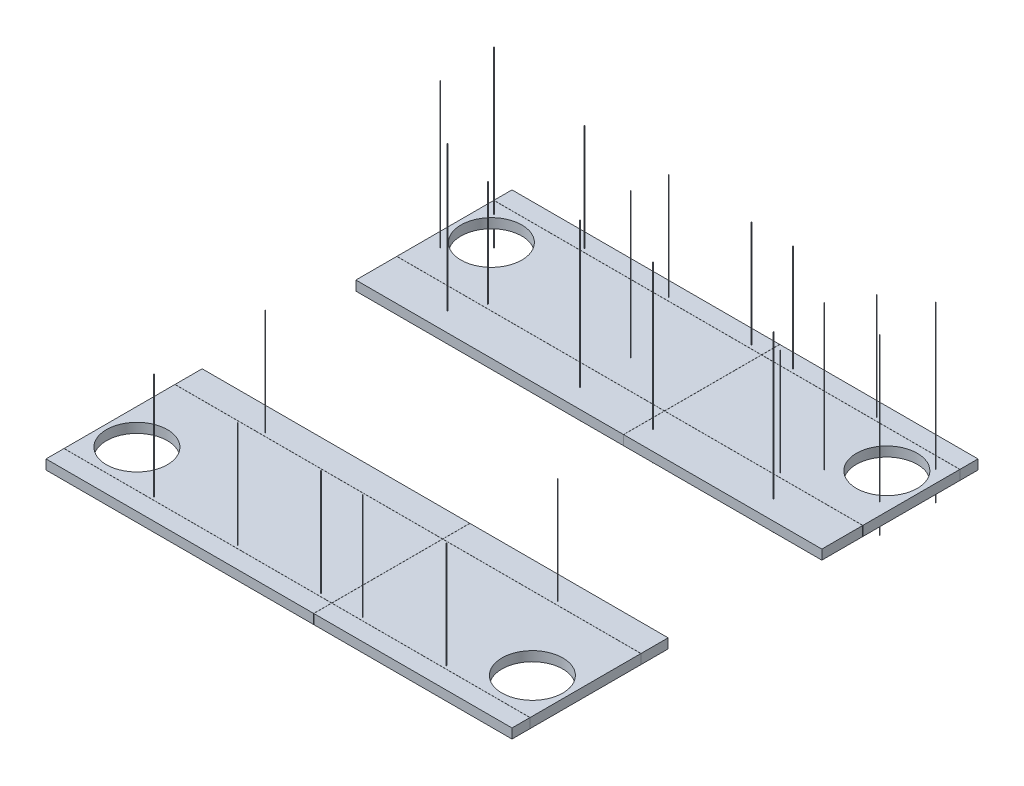
from build123d import *

# Parameters (mm, degrees)
SKETCH1_W                        = 4908.55
SKETCH1_H                        = 4908.55
BOSS_EXTRUDE1_DEPTH              = 101.6
SKETCH2_W                        = 4908.55
SKETCH2_H                        = 1619.25
CUT_EXTRUDE1_DEPTH               = 3473.355700566
SKETCH4_W                        = 4908.55
SKETCH4_H                        = 1.27
CUT_EXTRUDE_THIN1_DEPTH          = 3473.355700566
CUT_EXTRUDE_THIN2_DEPTH          = 3473.355700566
CUT_EXTRUDE_THIN2_DEPTH_BACK     = 3473.355700566
SKETCH5_W                        = 1.27
SKETCH5_H                        = 4908.55
SKETCH6_R                        = 320.675
CUT_EXTRUDE2_DEPTH               = 3473.355700566
STUD_LAYOUT_SKETCH_DEPTH         = 1524
STUD_LAYOUT_SKETCH_DEPTH_BACK    = 304.8
SKETCH7_R                        = 3.175
STUD_LAYOUT_SKETCH_2_DEPTH       = 1524
STUD_LAYOUT_SKETCH_2_DEPTH_BACK  = 304.8
STUD_LAYOUT_SKETCH_3_DEPTH       = 1524
STUD_LAYOUT_SKETCH_3_DEPTH_BACK  = 304.8
STUD_LAYOUT_SKETCH_4_DEPTH       = 1524
STUD_LAYOUT_SKETCH_4_DEPTH_BACK  = 304.8
STUD_LAYOUT_SKETCH_5_DEPTH       = 1524
STUD_LAYOUT_SKETCH_5_DEPTH_BACK  = 304.8
STUD_LAYOUT_SKETCH_6_DEPTH       = 1524
STUD_LAYOUT_SKETCH_6_DEPTH_BACK  = 304.8
STUD_LAYOUT_SKETCH_7_DEPTH       = 1524
STUD_LAYOUT_SKETCH_7_DEPTH_BACK  = 304.8
STUD_LAYOUT_SKETCH_8_DEPTH       = 1524
STUD_LAYOUT_SKETCH_8_DEPTH_BACK  = 304.8
STUD_LAYOUT_SKETCH_9_DEPTH       = 1524
STUD_LAYOUT_SKETCH_9_DEPTH_BACK  = 304.8
STUD_LAYOUT_SKETCH_10_DEPTH      = 1524
STUD_LAYOUT_SKETCH_10_DEPTH_BACK = 304.8
STUD_LAYOUT_SKETCH_11_DEPTH      = 1524
STUD_LAYOUT_SKETCH_11_DEPTH_BACK = 304.8
STUD_LAYOUT_SKETCH_12_DEPTH      = 1524
STUD_LAYOUT_SKETCH_12_DEPTH_BACK = 304.8
STUD_LAYOUT_SKETCH_13_DEPTH      = 1524
STUD_LAYOUT_SKETCH_13_DEPTH_BACK = 304.8
STUD_LAYOUT_SKETCH_14_DEPTH      = 1524
STUD_LAYOUT_SKETCH_14_DEPTH_BACK = 304.8
STUD_LAYOUT_SKETCH_15_DEPTH      = 1524
STUD_LAYOUT_SKETCH_15_DEPTH_BACK = 304.8
STUD_LAYOUT_SKETCH_16_DEPTH      = 1524
STUD_LAYOUT_SKETCH_16_DEPTH_BACK = 304.8
STUD_LAYOUT_SKETCH_17_DEPTH      = 1524
STUD_LAYOUT_SKETCH_17_DEPTH_BACK = 304.8
STUD_LAYOUT_SKETCH_18_DEPTH      = 1524
STUD_LAYOUT_SKETCH_18_DEPTH_BACK = 304.8
STUD_LAYOUT_SKETCH_19_DEPTH      = 1524
STUD_LAYOUT_SKETCH_19_DEPTH_BACK = 304.8
STUD_LAYOUT_SKETCH_20_DEPTH      = 1524
STUD_LAYOUT_SKETCH_20_DEPTH_BACK = 304.8
STUD_LAYOUT_SKETCH_21_DEPTH      = 1524
STUD_LAYOUT_SKETCH_21_DEPTH_BACK = 304.8
STUD_LAYOUT_SKETCH_22_DEPTH      = 1524
STUD_LAYOUT_SKETCH_22_DEPTH_BACK = 304.8
STUD_LAYOUT_SKETCH_23_DEPTH      = 1524
STUD_LAYOUT_SKETCH_23_DEPTH_BACK = 304.8
STUD_LAYOUT_SKETCH_24_DEPTH      = 1524
STUD_LAYOUT_SKETCH_24_DEPTH_BACK = 304.8
SKETCH8_W                        = 5497.787174958
SKETCH8_H                        = 7518.420007062
CUT_EXTRUDE5_DEPTH               = 406.4
SKETCH9_W                        = 5184.868781488
SKETCH9_H                        = 7370.4919608
CUT_EXTRUDE6_DEPTH               = 254


with BuildPart() as part:
    # Sketch1 → Boss-Extrude1 (new body)
    with BuildSketch(Plane(origin=(0, 0, 0), x_dir=(1, 0, 0), z_dir=(0, 1, 0))):
        Rectangle(SKETCH1_W, SKETCH1_H)
    extrude(amount=BOSS_EXTRUDE1_DEPTH)

    # Sketch2 → Cut-Extrude1 (cut, through all)
    with BuildSketch(Plane(origin=(0, 101.6, 0), x_dir=(1, 0, 0), z_dir=(0, 1, 0))):
        Rectangle(SKETCH2_W, SKETCH2_H)
    extrude(amount=-CUT_EXTRUDE1_DEPTH, mode=Mode.SUBTRACT)


with BuildPart() as cut_extrude1_piece_1:
    # of the separate pieces the step leaves, piece 1, a body of its own (cut_extrude1_pieces)
    add(part.part.solids().sort_by_distance((-2454.275, 0, -2454.275))[0])


with BuildPart() as cut_extrude1_piece_2:
    # of the separate pieces the step leaves, piece 2, a body of its own (cut_extrude1_pieces)
    add(part.part.solids().sort_by_distance((-2454.275, 0, 2454.275))[0])


with BuildPart() as cut_extrude_thin1_tool:
    # Sketch4 → Cut-Extrude-Thin1 (new, through all)
    with BuildSketch(Plane(origin=(0, 101.6, 0), x_dir=(1, 0, 0), z_dir=(0, 1, 0))):
        with Locations((0, -2264.41)):
            Rectangle(SKETCH4_W, SKETCH4_H)
        with Locations((0, -1096.01)):
            Rectangle(SKETCH4_W, SKETCH4_H)
        with Locations((0, 2263.14)):
            Rectangle(SKETCH4_W, SKETCH4_H)
        with Locations((0, 1240.79)):
            Rectangle(SKETCH4_W, SKETCH4_H)
    extrude(amount=-CUT_EXTRUDE_THIN1_DEPTH)


with BuildPart() as cut_extrude1_piece_1_1:
    add(cut_extrude1_piece_1.part)

    # Cut-Extrude-Thin1: cut by cut_extrude_thin1_tool
    add(cut_extrude_thin1_tool.part, mode=Mode.SUBTRACT)


with BuildPart() as cut_extrude1_piece_2_1:
    add(cut_extrude1_piece_2.part)

    # Cut-Extrude-Thin1: cut by cut_extrude_thin1_tool
    add(cut_extrude_thin1_tool.part, mode=Mode.SUBTRACT)


with BuildPart() as cut_extrude_thin1_piece_1:
    # of the separate pieces the step leaves, piece 1, a body of its own (cut_extrude_thin1_pieces)
    add(cut_extrude1_piece_1_1.part.solids().sort_by_distance((-2454.275, 0, -1241.425))[0])


with BuildPart() as cut_extrude_thin1_piece_2:
    # of the separate pieces the step leaves, piece 2, a body of its own (cut_extrude_thin1_pieces)
    add(cut_extrude1_piece_1_1.part.solids().sort_by_distance((-2454.275, 0, -809.625))[0])


with BuildPart() as cut_extrude_thin1_piece_3:
    # of the separate pieces the step leaves, piece 3, a body of its own (cut_extrude_thin1_pieces)
    add(cut_extrude1_piece_1_1.part.solids().sort_by_distance((-2454.275, 0, -2454.275))[0])


with BuildPart() as cut_extrude_thin1_piece_1_of_cut_extrude:
    # of the separate pieces the step leaves, piece 1, a body of its own (cut_extrude_thin1_pieces_of_cut_extrude1)
    add(cut_extrude1_piece_2_1.part.solids().sort_by_distance((-2454.275, 0, 2263.775))[0])


with BuildPart() as cut_extrude_thin1_piece_2_of_cut_extrude:
    # of the separate pieces the step leaves, piece 2, a body of its own (cut_extrude_thin1_pieces_of_cut_extrude1)
    add(cut_extrude1_piece_2_1.part.solids().sort_by_distance((-2454.275, 0, 1095.375))[0])


with BuildPart() as cut_extrude_thin1_piece_3_of_cut_extrude:
    # of the separate pieces the step leaves, piece 3, a body of its own (cut_extrude_thin1_pieces_of_cut_extrude1)
    add(cut_extrude1_piece_2_1.part.solids().sort_by_distance((-2454.275, 0, 2454.275))[0])


with BuildPart() as cut_extrude_thin2_tool:
    # Sketch5 → Cut-Extrude-Thin2 (new, two sides: drawn at the far end of the back side and taken through both)
    with BuildSketch(Plane(origin=(0, 101.6, 0), x_dir=(1, 0, 0), z_dir=(0, 1, 0)).offset(-CUT_EXTRUDE_THIN2_DEPTH_BACK)):
        with Locations((365.76, 0)):
            Rectangle(SKETCH5_W, SKETCH5_H)
    extrude(amount=CUT_EXTRUDE_THIN2_DEPTH + CUT_EXTRUDE_THIN2_DEPTH_BACK)


with BuildPart() as cut_extrude_thin1_piece_1_1:
    add(cut_extrude_thin1_piece_1.part)

    # Cut-Extrude-Thin2: cut by cut_extrude_thin2_tool
    add(cut_extrude_thin2_tool.part, mode=Mode.SUBTRACT)


with BuildPart() as cut_extrude_thin1_piece_2_1:
    add(cut_extrude_thin1_piece_2.part)

    # Cut-Extrude-Thin2: cut by cut_extrude_thin2_tool
    add(cut_extrude_thin2_tool.part, mode=Mode.SUBTRACT)


with BuildPart() as cut_extrude_thin1_piece_3_1:
    add(cut_extrude_thin1_piece_3.part)

    # Cut-Extrude-Thin2: cut by cut_extrude_thin2_tool
    add(cut_extrude_thin2_tool.part, mode=Mode.SUBTRACT)


with BuildPart() as cut_extrude_thin1_piece_1_of_cut_extrude_1:
    add(cut_extrude_thin1_piece_1_of_cut_extrude.part)

    # Cut-Extrude-Thin2: cut by cut_extrude_thin2_tool
    add(cut_extrude_thin2_tool.part, mode=Mode.SUBTRACT)


with BuildPart() as cut_extrude_thin1_piece_2_of_cut_extrude_1:
    add(cut_extrude_thin1_piece_2_of_cut_extrude.part)

    # Cut-Extrude-Thin2: cut by cut_extrude_thin2_tool
    add(cut_extrude_thin2_tool.part, mode=Mode.SUBTRACT)


with BuildPart() as cut_extrude_thin1_piece_3_of_cut_extrude_1:
    add(cut_extrude_thin1_piece_3_of_cut_extrude.part)

    # Cut-Extrude-Thin2: cut by cut_extrude_thin2_tool
    add(cut_extrude_thin2_tool.part, mode=Mode.SUBTRACT)


with BuildPart() as cut_extrude_thin2_piece_1:
    # of the separate pieces the step leaves, piece 1, a body of its own (cut_extrude_thin2_pieces)
    add(cut_extrude_thin1_piece_1_1.part.solids().sort_by_distance((-2454.275, 0, -1241.425))[0])


with BuildPart() as cut_extrude_thin2_piece_2:
    # of the separate pieces the step leaves, piece 2, a body of its own (cut_extrude_thin2_pieces)
    add(cut_extrude_thin1_piece_1_1.part.solids().sort_by_distance((2454.275, 0, -2262.505))[0])


with BuildPart() as cut_extrude_thin2_piece_1_of_cut_extrude:
    # of the separate pieces the step leaves, piece 1, a body of its own (cut_extrude_thin2_pieces_of_cut_extrude)
    add(cut_extrude_thin1_piece_2_1.part.solids().sort_by_distance((-2454.275, 0, -809.625))[0])


with BuildPart() as cut_extrude_thin2_piece_2_of_cut_extrude:
    # of the separate pieces the step leaves, piece 2, a body of its own (cut_extrude_thin2_pieces_of_cut_extrude)
    add(cut_extrude_thin1_piece_2_1.part.solids().sort_by_distance((2454.275, 0, -1240.155))[0])


with BuildPart() as cut_extrude_thin2_piece_1_of_cut_ext_2:
    # of the separate pieces the step leaves, piece 1, a body of its own (cut_extrude_thin2_pieces_of_cut_extr_2)
    add(cut_extrude_thin1_piece_3_1.part.solids().sort_by_distance((-2454.275, 0, -2454.275))[0])


with BuildPart() as cut_extrude_thin2_piece_2_of_cut_ext_2:
    # of the separate pieces the step leaves, piece 2, a body of its own (cut_extrude_thin2_pieces_of_cut_extr_2)
    add(cut_extrude_thin1_piece_3_1.part.solids().sort_by_distance((366.395, 0, -2454.275))[0])


with BuildPart() as cut_extrude_thin2_piece_1_of_cut_ext_3:
    # of the separate pieces the step leaves, piece 1, a body of its own (cut_extrude_thin2_pieces_of_cut_extr_3)
    add(cut_extrude_thin1_piece_1_of_cut_extrude_1.part.solids().sort_by_distance((-2454.275, 0, 2263.775))[0])


with BuildPart() as cut_extrude_thin2_piece_2_of_cut_ext_3:
    # of the separate pieces the step leaves, piece 2, a body of its own (cut_extrude_thin2_pieces_of_cut_extr_3)
    add(cut_extrude_thin1_piece_1_of_cut_extrude_1.part.solids().sort_by_distance((2454.275, 0, 1096.645))[0])


with BuildPart() as cut_extrude_thin2_piece_1_of_cut_ext_4:
    # of the separate pieces the step leaves, piece 1, a body of its own (cut_extrude_thin2_pieces_of_cut_extr_4)
    add(cut_extrude_thin1_piece_2_of_cut_extrude_1.part.solids().sort_by_distance((-2454.275, 0, 1095.375))[0])


with BuildPart() as cut_extrude_thin2_piece_2_of_cut_ext_4:
    # of the separate pieces the step leaves, piece 2, a body of its own (cut_extrude_thin2_pieces_of_cut_extr_4)
    add(cut_extrude_thin1_piece_2_of_cut_extrude_1.part.solids().sort_by_distance((2454.275, 0, 809.625))[0])


with BuildPart() as cut_extrude_thin2_piece_1_of_cut_ext_5:
    # of the separate pieces the step leaves, piece 1, a body of its own (cut_extrude_thin2_pieces_of_cut_extr_5)
    add(cut_extrude_thin1_piece_3_of_cut_extrude_1.part.solids().sort_by_distance((-2454.275, 0, 2454.275))[0])


with BuildPart() as cut_extrude_thin2_piece_2_of_cut_ext_5:
    # of the separate pieces the step leaves, piece 2, a body of its own (cut_extrude_thin2_pieces_of_cut_extr_5)
    add(cut_extrude_thin1_piece_3_of_cut_extrude_1.part.solids().sort_by_distance((2454.275, 0, 2265.045))[0])


with BuildPart() as cut_extrude2_tool:
    # Sketch6 → Cut-Extrude2 (new, through all)
    with BuildSketch(Plane(origin=(0, 101.6, 0), x_dir=(1, 0, 0), z_dir=(0, 1, 0))):
        with Locations((2082.8, 1865.63)):
            Circle(SKETCH6_R)
        with Locations((-2082.8, 1865.63)):
            Circle(SKETCH6_R)
        with Locations((-2082.8, -1868.17)):
            Circle(SKETCH6_R)
        with Locations((2082.8, -1868.17)):
            Circle(SKETCH6_R)
    extrude(amount=-CUT_EXTRUDE2_DEPTH)


with BuildPart() as cut_extrude_thin2_piece_1_1:
    add(cut_extrude_thin2_piece_1.part)

    # Cut-Extrude2: cut by cut_extrude2_tool
    add(cut_extrude2_tool.part, mode=Mode.SUBTRACT)


with BuildPart() as cut_extrude_thin2_piece_2_1:
    add(cut_extrude_thin2_piece_2.part)

    # Cut-Extrude2: cut by cut_extrude2_tool
    add(cut_extrude2_tool.part, mode=Mode.SUBTRACT)


with BuildPart() as cut_extrude_thin2_piece_1_of_cut_ext_3_1:
    add(cut_extrude_thin2_piece_1_of_cut_ext_3.part)

    # Cut-Extrude2: cut by cut_extrude2_tool
    add(cut_extrude2_tool.part, mode=Mode.SUBTRACT)


with BuildPart() as cut_extrude_thin2_piece_2_of_cut_ext_3_1:
    add(cut_extrude_thin2_piece_2_of_cut_ext_3.part)

    # Cut-Extrude2: cut by cut_extrude2_tool
    add(cut_extrude2_tool.part, mode=Mode.SUBTRACT)


with BuildPart() as body_13:
    # Sketch7 → STUD LAYOUT SKETCH (new, two sides: drawn at the far end of the back side and taken through both)
    with BuildSketch(Plane(origin=(0, 101.6, 0), x_dir=(1, 0, 0), z_dir=(0, 1, 0)).offset(-STUD_LAYOUT_SKETCH_DEPTH_BACK)):
        with Locations((-1539.875, 2301.875)):
            Circle(SKETCH7_R)
    extrude(amount=STUD_LAYOUT_SKETCH_DEPTH + STUD_LAYOUT_SKETCH_DEPTH_BACK)


with BuildPart() as body_14:
    # Sketch7 → STUD LAYOUT SKETCH 2 (new, two sides: drawn at the far end of the back side and taken through both)
    with BuildSketch(Plane(origin=(0, 101.6, 0), x_dir=(1, 0, 0), z_dir=(0, 1, 0)).offset(-STUD_LAYOUT_SKETCH_2_DEPTH_BACK)):
        with Locations((1743.075, 1546.225)):
            Circle(SKETCH7_R)
    extrude(amount=STUD_LAYOUT_SKETCH_2_DEPTH + STUD_LAYOUT_SKETCH_2_DEPTH_BACK)


with BuildPart() as body_15:
    # Sketch7 → STUD LAYOUT SKETCH 3 (new, two sides: drawn at the far end of the back side and taken through both)
    with BuildSketch(Plane(origin=(0, 101.6, 0), x_dir=(1, 0, 0), z_dir=(0, 1, 0)).offset(-STUD_LAYOUT_SKETCH_3_DEPTH_BACK)):
        with Locations((473.075, 1012.825)):
            Circle(SKETCH7_R)
    extrude(amount=STUD_LAYOUT_SKETCH_3_DEPTH + STUD_LAYOUT_SKETCH_3_DEPTH_BACK)


with BuildPart() as body_16:
    # Sketch7 → STUD LAYOUT SKETCH 4 (new, two sides: drawn at the far end of the back side and taken through both)
    with BuildSketch(Plane(origin=(0, 101.6, 0), x_dir=(1, 0, 0), z_dir=(0, 1, 0)).offset(-STUD_LAYOUT_SKETCH_4_DEPTH_BACK)):
        with Locations((-295.275, 1546.225)):
            Circle(SKETCH7_R)
    extrude(amount=STUD_LAYOUT_SKETCH_4_DEPTH + STUD_LAYOUT_SKETCH_4_DEPTH_BACK)


with BuildPart() as body_17:
    # Sketch7 → STUD LAYOUT SKETCH 5 (new, two sides: drawn at the far end of the back side and taken through both)
    with BuildSketch(Plane(origin=(0, 101.6, 0), x_dir=(1, 0, 0), z_dir=(0, 1, 0)).offset(-STUD_LAYOUT_SKETCH_5_DEPTH_BACK)):
        with Locations((-295.275, 1012.825)):
            Circle(SKETCH7_R)
    extrude(amount=STUD_LAYOUT_SKETCH_5_DEPTH + STUD_LAYOUT_SKETCH_5_DEPTH_BACK)


with BuildPart() as body_18:
    # Sketch7 → STUD LAYOUT SKETCH 6 (new, two sides: drawn at the far end of the back side and taken through both)
    with BuildSketch(Plane(origin=(0, 101.6, 0), x_dir=(1, 0, 0), z_dir=(0, 1, 0)).offset(-STUD_LAYOUT_SKETCH_6_DEPTH_BACK)):
        with Locations((-1692.275, 1012.825)):
            Circle(SKETCH7_R)
    extrude(amount=STUD_LAYOUT_SKETCH_6_DEPTH + STUD_LAYOUT_SKETCH_6_DEPTH_BACK)


with BuildPart() as body_19:
    # Sketch7 → STUD LAYOUT SKETCH 7 (new, two sides: drawn at the far end of the back side and taken through both)
    with BuildSketch(Plane(origin=(0, 101.6, 0), x_dir=(1, 0, 0), z_dir=(0, 1, 0)).offset(-STUD_LAYOUT_SKETCH_7_DEPTH_BACK)):
        with Locations((1743.075, 1012.825)):
            Circle(SKETCH7_R)
    extrude(amount=STUD_LAYOUT_SKETCH_7_DEPTH + STUD_LAYOUT_SKETCH_7_DEPTH_BACK)


with BuildPart() as body_20:
    # Sketch7 → STUD LAYOUT SKETCH 8 (new, two sides: drawn at the far end of the back side and taken through both)
    with BuildSketch(Plane(origin=(0, 101.6, 0), x_dir=(1, 0, 0), z_dir=(0, 1, 0)).offset(-STUD_LAYOUT_SKETCH_8_DEPTH_BACK)):
        with Locations((-2301.875, 1546.225)):
            Circle(SKETCH7_R)
    extrude(amount=STUD_LAYOUT_SKETCH_8_DEPTH + STUD_LAYOUT_SKETCH_8_DEPTH_BACK)


with BuildPart() as body_21:
    # Sketch7 → STUD LAYOUT SKETCH 9 (new, two sides: drawn at the far end of the back side and taken through both)
    with BuildSketch(Plane(origin=(0, 101.6, 0), x_dir=(1, 0, 0), z_dir=(0, 1, 0)).offset(-STUD_LAYOUT_SKETCH_9_DEPTH_BACK)):
        with Locations((2327.275, 1546.225)):
            Circle(SKETCH7_R)
    extrude(amount=STUD_LAYOUT_SKETCH_9_DEPTH + STUD_LAYOUT_SKETCH_9_DEPTH_BACK)


with BuildPart() as body_22:
    # Sketch7 → STUD LAYOUT SKETCH 10 (new, two sides: drawn at the far end of the back side and taken through both)
    with BuildSketch(Plane(origin=(0, 101.6, 0), x_dir=(1, 0, 0), z_dir=(0, 1, 0)).offset(-STUD_LAYOUT_SKETCH_10_DEPTH_BACK)):
        with Locations((-2327.275, 2136.775)):
            Circle(SKETCH7_R)
    extrude(amount=STUD_LAYOUT_SKETCH_10_DEPTH + STUD_LAYOUT_SKETCH_10_DEPTH_BACK)


with BuildPart() as body_23:
    # Sketch7 → STUD LAYOUT SKETCH 11 (new, two sides: drawn at the far end of the back side and taken through both)
    with BuildSketch(Plane(origin=(0, 101.6, 0), x_dir=(1, 0, 0), z_dir=(0, 1, 0)).offset(-STUD_LAYOUT_SKETCH_11_DEPTH_BACK)):
        with Locations((2327.275, 2136.775)):
            Circle(SKETCH7_R)
    extrude(amount=STUD_LAYOUT_SKETCH_11_DEPTH + STUD_LAYOUT_SKETCH_11_DEPTH_BACK)


with BuildPart() as body_24:
    # Sketch7 → STUD LAYOUT SKETCH 12 (new, two sides: drawn at the far end of the back side and taken through both)
    with BuildSketch(Plane(origin=(0, 101.6, 0), x_dir=(1, 0, 0), z_dir=(0, 1, 0)).offset(-STUD_LAYOUT_SKETCH_12_DEPTH_BACK)):
        with Locations((219.075, 2301.875)):
            Circle(SKETCH7_R)
    extrude(amount=STUD_LAYOUT_SKETCH_12_DEPTH + STUD_LAYOUT_SKETCH_12_DEPTH_BACK)


with BuildPart() as body_25:
    # Sketch7 → STUD LAYOUT SKETCH 13 (new, two sides: drawn at the far end of the back side and taken through both)
    with BuildSketch(Plane(origin=(0, 101.6, 0), x_dir=(1, 0, 0), z_dir=(0, 1, 0)).offset(-STUD_LAYOUT_SKETCH_13_DEPTH_BACK)):
        with Locations((658.495, 2301.875)):
            Circle(SKETCH7_R)
    extrude(amount=STUD_LAYOUT_SKETCH_13_DEPTH + STUD_LAYOUT_SKETCH_13_DEPTH_BACK)


with BuildPart() as body_26:
    # Sketch7 → STUD LAYOUT SKETCH 14 (new, two sides: drawn at the far end of the back side and taken through both)
    with BuildSketch(Plane(origin=(0, 101.6, 0), x_dir=(1, 0, 0), z_dir=(0, 1, 0)).offset(-STUD_LAYOUT_SKETCH_14_DEPTH_BACK)):
        with Locations((1539.875, 2301.875)):
            Circle(SKETCH7_R)
    extrude(amount=STUD_LAYOUT_SKETCH_14_DEPTH + STUD_LAYOUT_SKETCH_14_DEPTH_BACK)


with BuildPart() as body_27:
    # Sketch7 → STUD LAYOUT SKETCH 15 (new, two sides: drawn at the far end of the back side and taken through both)
    with BuildSketch(Plane(origin=(0, 101.6, 0), x_dir=(1, 0, 0), z_dir=(0, 1, 0)).offset(-STUD_LAYOUT_SKETCH_15_DEPTH_BACK)):
        with Locations((-650.875, 2301.875)):
            Circle(SKETCH7_R)
    extrude(amount=STUD_LAYOUT_SKETCH_15_DEPTH + STUD_LAYOUT_SKETCH_15_DEPTH_BACK)


with BuildPart() as body_28:
    # Sketch7 → STUD LAYOUT SKETCH 16 (new, two sides: drawn at the far end of the back side and taken through both)
    with BuildSketch(Plane(origin=(0, 101.6, 0), x_dir=(1, 0, 0), z_dir=(0, 1, 0)).offset(-STUD_LAYOUT_SKETCH_16_DEPTH_BACK)):
        with Locations((-1539.875, 1285.875)):
            Circle(SKETCH7_R)
    extrude(amount=STUD_LAYOUT_SKETCH_16_DEPTH + STUD_LAYOUT_SKETCH_16_DEPTH_BACK)


with BuildPart() as body_29:
    # Sketch7 → STUD LAYOUT SKETCH 17 (new, two sides: drawn at the far end of the back side and taken through both)
    with BuildSketch(Plane(origin=(0, 101.6, 0), x_dir=(1, 0, 0), z_dir=(0, 1, 0)).offset(-STUD_LAYOUT_SKETCH_17_DEPTH_BACK)):
        with Locations((1539.875, 1285.875)):
            Circle(SKETCH7_R)
    extrude(amount=STUD_LAYOUT_SKETCH_17_DEPTH + STUD_LAYOUT_SKETCH_17_DEPTH_BACK)


with BuildPart() as body_30:
    # Sketch7 → STUD LAYOUT SKETCH 18 (new, two sides: drawn at the far end of the back side and taken through both)
    with BuildSketch(Plane(origin=(0, 101.6, 0), x_dir=(1, 0, 0), z_dir=(0, 1, 0)).offset(-STUD_LAYOUT_SKETCH_18_DEPTH_BACK)):
        with Locations((-1539.875, -1058.595975439)):
            Circle(SKETCH7_R)
    extrude(amount=STUD_LAYOUT_SKETCH_18_DEPTH + STUD_LAYOUT_SKETCH_18_DEPTH_BACK)


with BuildPart() as body_31:
    # Sketch7 → STUD LAYOUT SKETCH 19 (new, two sides: drawn at the far end of the back side and taken through both)
    with BuildSketch(Plane(origin=(0, 101.6, 0), x_dir=(1, 0, 0), z_dir=(0, 1, 0)).offset(-STUD_LAYOUT_SKETCH_19_DEPTH_BACK)):
        with Locations((-1539.875, -2230.249923642)):
            Circle(SKETCH7_R)
    extrude(amount=STUD_LAYOUT_SKETCH_19_DEPTH + STUD_LAYOUT_SKETCH_19_DEPTH_BACK)


with BuildPart() as body_32:
    # Sketch7 → STUD LAYOUT SKETCH 20 (new, two sides: drawn at the far end of the back side and taken through both)
    with BuildSketch(Plane(origin=(0, 101.6, 0), x_dir=(1, 0, 0), z_dir=(0, 1, 0)).offset(-STUD_LAYOUT_SKETCH_20_DEPTH_BACK)):
        with Locations((-658.765974284, -2230.249923642)):
            Circle(SKETCH7_R)
    extrude(amount=STUD_LAYOUT_SKETCH_20_DEPTH + STUD_LAYOUT_SKETCH_20_DEPTH_BACK)


with BuildPart() as body_33:
    # Sketch7 → STUD LAYOUT SKETCH 21 (new, two sides: drawn at the far end of the back side and taken through both)
    with BuildSketch(Plane(origin=(0, 101.6, 0), x_dir=(1, 0, 0), z_dir=(0, 1, 0)).offset(-STUD_LAYOUT_SKETCH_21_DEPTH_BACK)):
        with Locations((219.075, -2230.249923642)):
            Circle(SKETCH7_R)
    extrude(amount=STUD_LAYOUT_SKETCH_21_DEPTH + STUD_LAYOUT_SKETCH_21_DEPTH_BACK)


with BuildPart() as body_34:
    # Sketch7 → STUD LAYOUT SKETCH 22 (new, two sides: drawn at the far end of the back side and taken through both)
    with BuildSketch(Plane(origin=(0, 101.6, 0), x_dir=(1, 0, 0), z_dir=(0, 1, 0)).offset(-STUD_LAYOUT_SKETCH_22_DEPTH_BACK)):
        with Locations((658.495, -2230.249923642)):
            Circle(SKETCH7_R)
    extrude(amount=STUD_LAYOUT_SKETCH_22_DEPTH + STUD_LAYOUT_SKETCH_22_DEPTH_BACK)


with BuildPart() as body_35:
    # Sketch7 → STUD LAYOUT SKETCH 23 (new, two sides: drawn at the far end of the back side and taken through both)
    with BuildSketch(Plane(origin=(0, 101.6, 0), x_dir=(1, 0, 0), z_dir=(0, 1, 0)).offset(-STUD_LAYOUT_SKETCH_23_DEPTH_BACK)):
        with Locations((1539.875, -2230.249923642)):
            Circle(SKETCH7_R)
    extrude(amount=STUD_LAYOUT_SKETCH_23_DEPTH + STUD_LAYOUT_SKETCH_23_DEPTH_BACK)


with BuildPart() as body_36:
    # Sketch7 → STUD LAYOUT SKETCH 24 (new, two sides: drawn at the far end of the back side and taken through both)
    with BuildSketch(Plane(origin=(0, 101.6, 0), x_dir=(1, 0, 0), z_dir=(0, 1, 0)).offset(-STUD_LAYOUT_SKETCH_24_DEPTH_BACK)):
        with Locations((1539.875, -1058.595975439)):
            Circle(SKETCH7_R)
    extrude(amount=STUD_LAYOUT_SKETCH_24_DEPTH + STUD_LAYOUT_SKETCH_24_DEPTH_BACK)


with BuildPart() as cut_extrude5_tool:
    # Sketch8 → Cut-Extrude5 (new body)
    with BuildSketch(Plane(origin=(0, 1625.6, 0), x_dir=(1, 0, 0), z_dir=(0, 1, 0))):
        Rectangle(SKETCH8_W, SKETCH8_H)
    extrude(amount=-CUT_EXTRUDE5_DEPTH)


with BuildPart() as body_13_1:
    add(body_13.part)

    # Cut-Extrude5: cut by cut_extrude5_tool
    add(cut_extrude5_tool.part, mode=Mode.SUBTRACT)


with BuildPart() as body_24_1:
    add(body_24.part)

    # Cut-Extrude5: cut by cut_extrude5_tool
    add(cut_extrude5_tool.part, mode=Mode.SUBTRACT)


with BuildPart() as body_25_1:
    add(body_25.part)

    # Cut-Extrude5: cut by cut_extrude5_tool
    add(cut_extrude5_tool.part, mode=Mode.SUBTRACT)


with BuildPart() as body_26_1:
    add(body_26.part)

    # Cut-Extrude5: cut by cut_extrude5_tool
    add(cut_extrude5_tool.part, mode=Mode.SUBTRACT)


with BuildPart() as body_27_1:
    add(body_27.part)

    # Cut-Extrude5: cut by cut_extrude5_tool
    add(cut_extrude5_tool.part, mode=Mode.SUBTRACT)


with BuildPart() as body_28_1:
    add(body_28.part)

    # Cut-Extrude5: cut by cut_extrude5_tool
    add(cut_extrude5_tool.part, mode=Mode.SUBTRACT)


with BuildPart() as body_29_1:
    add(body_29.part)

    # Cut-Extrude5: cut by cut_extrude5_tool
    add(cut_extrude5_tool.part, mode=Mode.SUBTRACT)


with BuildPart() as body_30_1:
    add(body_30.part)

    # Cut-Extrude5: cut by cut_extrude5_tool
    add(cut_extrude5_tool.part, mode=Mode.SUBTRACT)


with BuildPart() as body_31_1:
    add(body_31.part)

    # Cut-Extrude5: cut by cut_extrude5_tool
    add(cut_extrude5_tool.part, mode=Mode.SUBTRACT)


with BuildPart() as body_32_1:
    add(body_32.part)

    # Cut-Extrude5: cut by cut_extrude5_tool
    add(cut_extrude5_tool.part, mode=Mode.SUBTRACT)


with BuildPart() as body_33_1:
    add(body_33.part)

    # Cut-Extrude5: cut by cut_extrude5_tool
    add(cut_extrude5_tool.part, mode=Mode.SUBTRACT)


with BuildPart() as body_34_1:
    add(body_34.part)

    # Cut-Extrude5: cut by cut_extrude5_tool
    add(cut_extrude5_tool.part, mode=Mode.SUBTRACT)


with BuildPart() as body_35_1:
    add(body_35.part)

    # Cut-Extrude5: cut by cut_extrude5_tool
    add(cut_extrude5_tool.part, mode=Mode.SUBTRACT)


with BuildPart() as body_36_1:
    add(body_36.part)

    # Cut-Extrude5: cut by cut_extrude5_tool
    add(cut_extrude5_tool.part, mode=Mode.SUBTRACT)


with BuildPart() as cut_extrude6_tool:
    # Sketch9 → Cut-Extrude6 (new body)
    with BuildSketch(Plane.XZ.offset(203.2)):
        Rectangle(SKETCH9_W, SKETCH9_H)
    extrude(amount=-CUT_EXTRUDE6_DEPTH)


with BuildPart() as body_13_2:
    add(body_13_1.part)

    # Cut-Extrude6: cut by cut_extrude6_tool
    add(cut_extrude6_tool.part, mode=Mode.SUBTRACT)


with BuildPart() as body_24_2:
    add(body_24_1.part)

    # Cut-Extrude6: cut by cut_extrude6_tool
    add(cut_extrude6_tool.part, mode=Mode.SUBTRACT)


with BuildPart() as body_25_2:
    add(body_25_1.part)

    # Cut-Extrude6: cut by cut_extrude6_tool
    add(cut_extrude6_tool.part, mode=Mode.SUBTRACT)


with BuildPart() as body_26_2:
    add(body_26_1.part)

    # Cut-Extrude6: cut by cut_extrude6_tool
    add(cut_extrude6_tool.part, mode=Mode.SUBTRACT)


with BuildPart() as body_27_2:
    add(body_27_1.part)

    # Cut-Extrude6: cut by cut_extrude6_tool
    add(cut_extrude6_tool.part, mode=Mode.SUBTRACT)


with BuildPart() as body_28_2:
    add(body_28_1.part)

    # Cut-Extrude6: cut by cut_extrude6_tool
    add(cut_extrude6_tool.part, mode=Mode.SUBTRACT)


with BuildPart() as body_29_2:
    add(body_29_1.part)

    # Cut-Extrude6: cut by cut_extrude6_tool
    add(cut_extrude6_tool.part, mode=Mode.SUBTRACT)


with BuildPart() as body_30_2:
    add(body_30_1.part)

    # Cut-Extrude6: cut by cut_extrude6_tool
    add(cut_extrude6_tool.part, mode=Mode.SUBTRACT)


with BuildPart() as body_31_2:
    add(body_31_1.part)

    # Cut-Extrude6: cut by cut_extrude6_tool
    add(cut_extrude6_tool.part, mode=Mode.SUBTRACT)


with BuildPart() as body_32_2:
    add(body_32_1.part)

    # Cut-Extrude6: cut by cut_extrude6_tool
    add(cut_extrude6_tool.part, mode=Mode.SUBTRACT)


with BuildPart() as body_33_2:
    add(body_33_1.part)

    # Cut-Extrude6: cut by cut_extrude6_tool
    add(cut_extrude6_tool.part, mode=Mode.SUBTRACT)


with BuildPart() as body_34_2:
    add(body_34_1.part)

    # Cut-Extrude6: cut by cut_extrude6_tool
    add(cut_extrude6_tool.part, mode=Mode.SUBTRACT)


with BuildPart() as body_35_2:
    add(body_35_1.part)

    # Cut-Extrude6: cut by cut_extrude6_tool
    add(cut_extrude6_tool.part, mode=Mode.SUBTRACT)


with BuildPart() as body_36_2:
    add(body_36_1.part)

    # Cut-Extrude6: cut by cut_extrude6_tool
    add(cut_extrude6_tool.part, mode=Mode.SUBTRACT)


solid = Compound([cut_extrude_thin2_piece_1_of_cut_extrude.part, cut_extrude_thin2_piece_2_of_cut_extrude.part, cut_extrude_thin2_piece_1_of_cut_ext_2.part, cut_extrude_thin2_piece_2_of_cut_ext_2.part, cut_extrude_thin2_piece_1_of_cut_ext_4.part, cut_extrude_thin2_piece_2_of_cut_ext_4.part, cut_extrude_thin2_piece_1_of_cut_ext_5.part, cut_extrude_thin2_piece_2_of_cut_ext_5.part, cut_extrude_thin2_piece_1_1.part, cut_extrude_thin2_piece_2_1.part, cut_extrude_thin2_piece_1_of_cut_ext_3_1.part, cut_extrude_thin2_piece_2_of_cut_ext_3_1.part, body_14.part, body_15.part, body_16.part, body_17.part, body_18.part, body_19.part, body_20.part, body_21.part, body_22.part, body_23.part, body_13_2.part, body_24_2.part, body_25_2.part, body_26_2.part, body_27_2.part, body_28_2.part, body_29_2.part, body_30_2.part, body_31_2.part, body_32_2.part, body_33_2.part, body_34_2.part, body_35_2.part, body_36_2.part])
